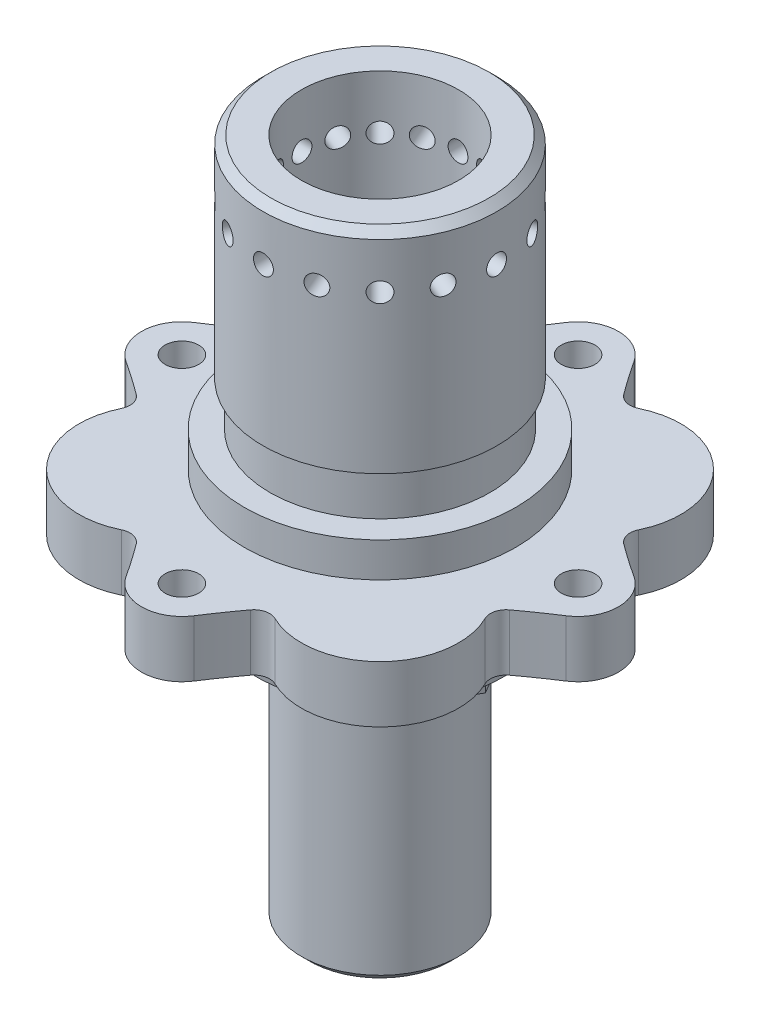
from build123d import *

# Parameters (mm, degrees)
SKETCH5_W                     = 15.875
SKETCH5_H                     = 79.375
DRIVE_PIN_HOLES_D             = 6.8
DRIVE_PIN_HOLES_PATTERN_COUNT = 4
FLANGE_SUPPORT_CUT_REACH      = 103.939
SKETCH8_R                     = 52.5
SKETCH10_R                    = 25.0825
BRAKE_HAT_HEX_DEPTH           = 4.7625
F_5_16_CLEARANCE_HOLE1_D      = 8.4328
SKETCH14_R                    = 2
PIN_HOLES_DEPTH               = 98.561648779
PIN_HOLE_PATTERN_COUNT        = 16
FILLET1_R                     = 3.175


with BuildPart() as part:
    # Sketch1 → Bearing Shaft/Flange Support (revolve)
    with BuildSketch(Plane(origin=(0, 0, 0), x_dir=(0, 0, -1), z_dir=(1, 0, 0))):
        Polygon((0, 0), (-27.254672075, 0), (-25.0825, -12.319), (-25.0825, -17.0815), (-15.875, -17.0815), (-15.875, -65.8749), (-14.2875, -67.4624), (0, -67.4624), align=None)
    revolve(axis=Axis((0, 0, 0), (0, 1, 0)))

    # Sketch2 → Drive Pin Support (revolve)
    with BuildSketch(Plane(origin=(0, 0, 0), x_dir=(0, 0, -1), z_dir=(1, 0, 0))):
        Polygon((0, 0), (-52.5, 0), (-52.5, 11.43), (-27.4096, 11.43), (-27.4096, 18.43), (-22.225, 18.43), (-22.225, 27.305), (-23.61946, 27.305), (-23.61946, 68.2625), (-22.03196, 69.85), (0, 69.85), align=None)
    revolve(axis=Axis((0, 0, 0), (0, 1, 0)))

    # Sketch5 → Center Mass Removal (revolve, cut)
    with BuildSketch(Plane(origin=(0, 0, 0), x_dir=(0, 0, -1), z_dir=(1, 0, 0))):
        with Locations((7.9375, 30.1625)):
            Rectangle(SKETCH5_W, SKETCH5_H)
    revolve(axis=Axis((0, 0, 0), (0, -1, 0)), mode=Mode.SUBTRACT)

    # Drive Pin Holes (through all)
    with Locations(Plane(origin=(0, 0, 0), x_dir=(-1, 0, 0), z_dir=(0, -1, 0))):
        with Locations((0, -40)):
            drive_pin_holes = Hole(DRIVE_PIN_HOLES_D / 2)

    # Drive Pin Holes Pattern: Drive Pin Holes ×4 about axis
    drive_pin_holes_pattern_axis = Axis((0, 0, 0), (0, -1, 0))
    for i in range(1, DRIVE_PIN_HOLES_PATTERN_COUNT):
        add(drive_pin_holes.rotate(drive_pin_holes_pattern_axis, i * 360 / DRIVE_PIN_HOLES_PATTERN_COUNT), mode=Mode.SUBTRACT)

    # Sketch8 → Flange Support Cut (cut, up to next)
    with BuildSketch(Plane.XZ, mode=Mode.PRIVATE) as flange_support_cut_sk1:
        Circle(SKETCH8_R)
        with BuildLine():
            ThreePointArc((-6.851776468, 44.436165629), (0, 48.1625), (6.851776468, 44.436165629))
            ThreePointArc((6.851776468, 44.436165629), (9.964767607, 39.850591878), (13.274865482, 35.405206349))
            ThreePointArc((13.274865482, 35.405206349), (33.675960454, 33.675960454), (35.405206349, 13.274865482))
            ThreePointArc((35.405206349, 13.274865482), (39.850591878, 9.964767607), (44.436165629, 6.851776468))
            ThreePointArc((44.436165629, 6.851776468), (48.1625, 0), (44.436165629, -6.851776468))
            ThreePointArc((44.436165629, -6.851776468), (39.850591878, -9.964767607), (35.405206349, -13.274865482))
            ThreePointArc((35.405206349, -13.274865482), (33.675960454, -33.675960454), (13.274865482, -35.405206349))
            ThreePointArc((13.274865482, -35.405206349), (9.964767607, -39.850591878), (6.851776468, -44.436165629))
            ThreePointArc((6.851776468, -44.436165629), (0, -48.1625), (-6.851776468, -44.436165629))
            ThreePointArc((-6.851776468, -44.436165629), (-9.964767607, -39.850591878), (-13.274865482, -35.405206349))
            ThreePointArc((-13.274865482, -35.405206349), (-33.675960454, -33.675960454), (-35.405206349, -13.274865482))
            ThreePointArc((-35.405206349, -13.274865482), (-39.850591878, -9.964767607), (-44.436165629, -6.851776468))
            ThreePointArc((-44.436165629, -6.851776468), (-48.1625, 0), (-44.436165629, 6.851776468))
            ThreePointArc((-44.436165629, 6.851776468), (-39.850591878, 9.964767607), (-35.405206349, 13.274865482))
            ThreePointArc((-35.405206349, 13.274865482), (-33.675960454, 33.675960454), (-13.274865482, 35.405206349))
            ThreePointArc((-13.274865482, 35.405206349), (-9.964767607, 39.850591878), (-6.851776468, 44.436165629))
        make_face(mode=Mode.SUBTRACT)
    flange_support_cut_tool1 = extrude(flange_support_cut_sk1.sketch, amount=-FLANGE_SUPPORT_CUT_REACH, mode=Mode.PRIVATE) & part.part
    add(flange_support_cut_tool1.solids().sort_by_distance((-51.015076, 0, 0))[0], mode=Mode.SUBTRACT)

    # Sketch10 → Brake Hat Hex (cut)
    with BuildSketch(Plane.XZ.offset(17.0815)):
        Circle(SKETCH10_R)
        Polygon((10.631905207, -18.415), (21.263810414, 0), (10.631905207, 18.415), (-10.631905207, 18.415), (-21.263810414, 0), (-10.631905207, -18.415), align=None, mode=Mode.SUBTRACT)
    extrude(amount=-BRAKE_HAT_HEX_DEPTH, mode=Mode.SUBTRACT)

    # 5/16 Clearance Hole1 (through all)
    with Locations(Plane(origin=(0, -67.4624, 0), x_dir=(-1, 0, 0), z_dir=(0, -1, 0))):
        with Locations((0, 0)):
            Hole(F_5_16_CLEARANCE_HOLE1_D / 2)

    # Sketch14 → Pin Holes (cut, through all)
    with BuildSketch(Plane(origin=(0, 0, 0), x_dir=(0, 0, -1), z_dir=(1, 0, 0))):
        with Locations((0, 59.05)):
            Circle(SKETCH14_R)
    pin_holes = extrude(amount=-PIN_HOLES_DEPTH, mode=Mode.SUBTRACT)

    # Pin Hole Pattern: Pin Holes ×16 about axis
    pin_hole_pattern_axis = Axis((0, 0, 0), (0, -1, 0))
    for i in range(1, PIN_HOLE_PATTERN_COUNT):
        add(pin_holes.rotate(pin_hole_pattern_axis, i * 360 / PIN_HOLE_PATTERN_COUNT), mode=Mode.SUBTRACT)

    # Fillet1
    fillet1_edges = [part.edges().sort_by_distance(p)[0] for p in [
        (-13.274865482, 5.715, 35.405206349),
        (-35.405206349, 5.715, 13.274865482),
        (-35.405206349, 5.715, -13.274865482),
        (-13.274865482, 5.715, -35.405206349),
        (13.274865482, 5.715, -35.405206349),
        (35.405206349, 5.715, -13.274865482),
        (35.405206349, 5.715, 13.274865482),
        (13.274865482, 5.715, 35.405206349),
    ]]
    fillet(fillet1_edges, radius=FILLET1_R)


solid = part.part
